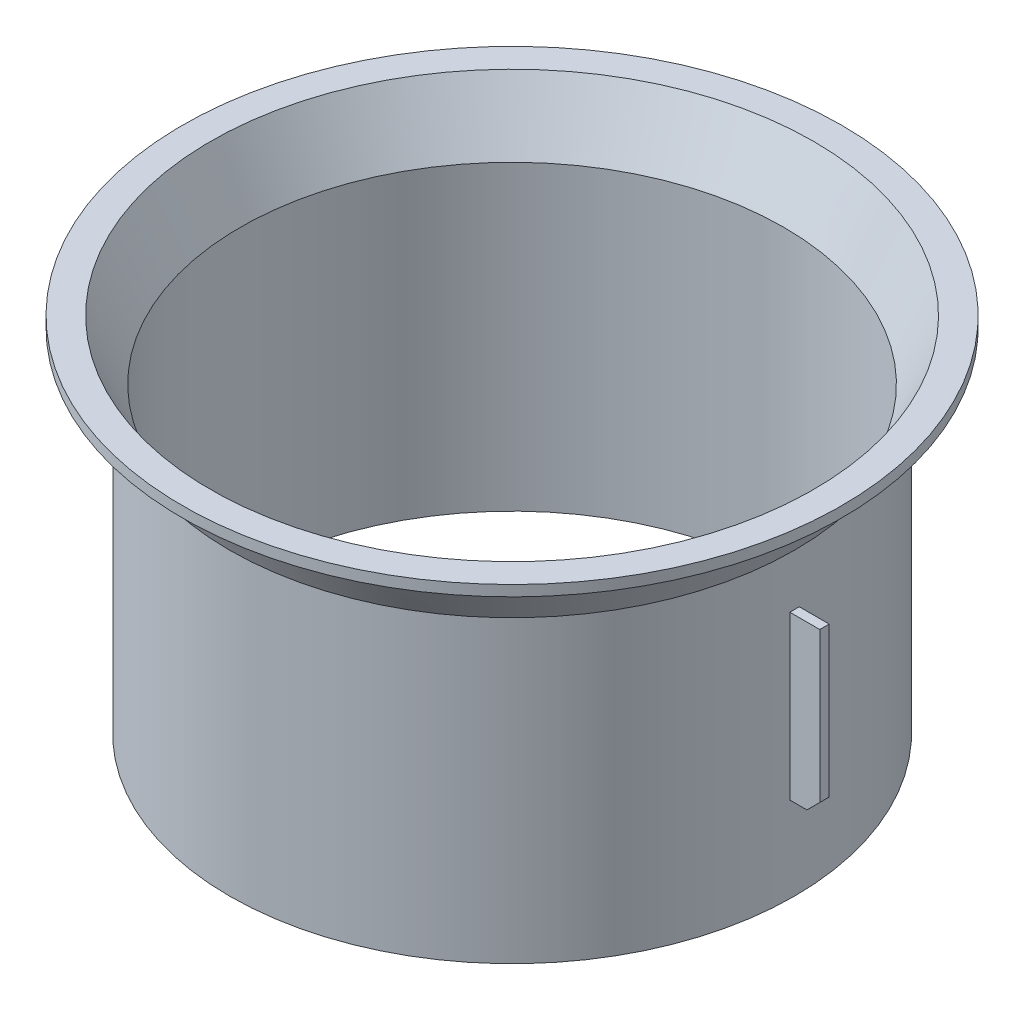
from build123d import *

# Parameters (mm, degrees)
BOSS_EXTRU_1_START = -10
BOSS_EXTRU_1_DEPTH = 19
CHANFREIN1_SIZE    = 1.5


with BuildPart() as part:
    # Esquisse1 → Révolution1 (revolve)
    with BuildSketch(Plane.XY):
        Polygon((33, 0), (33, 35), (36, 41), (38.5, 41), (38.5, 42.25), (35.227457514, 42.25), (31.75, 35.295084972), (31.75, 0), align=None)
    revolve(axis=Axis((0, 0, 0), (0, 1, 0)))

    # Esquisse2 → Boss.-Extru.1 (add)
    with BuildSketch(Plane.XZ.offset(BOSS_EXTRU_1_START)):
        Polygon((-32.995416348, 0.55), (-36.495416348, 0.55), (-36.495416348, -0.55), (-32.995416348, -0.55), (-32.495416348, 0), align=None)
        Polygon((32.995416348, -0.55), (36.495416348, -0.55), (36.495416348, 0.55), (32.995416348, 0.55), (32.495416348, 0), align=None)
    extrude(amount=-BOSS_EXTRU_1_DEPTH)

    # Chanfrein1
    chanfrein1_edges = [part.edges().sort_by_distance(p)[0] for p in [
        (36.495416348, 10, 0),
        (-36.495416348, 10, 0),
    ]]
    chamfer(chanfrein1_edges, length=CHANFREIN1_SIZE)


solid = part.part
